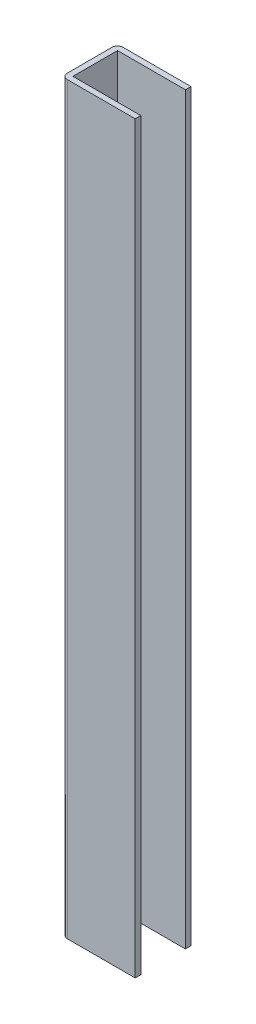
from build123d import *

# Parameters (mm, degrees)
SKETCH_1_W          = 74
SKETCH_1_H          = 24
EXTRUDE_1_DEPTH     = 400
SKETCH_2_W          = 41.646480438
SKETCH_2_H          = 42.526894273
CUT_EXTRUDE_1_DEPTH = 403.27478171


with BuildPart() as part:
    # Эскиз1 → Вытянуть-Тонкостенный1 (new body)
    with BuildSketch(Plane(origin=(0, 0, 0), x_dir=(1, 0, 0), z_dir=(0, 1, 0))):
        with BuildLine():
            Line((40, 12), (40, -12))
            ThreePointArc((40, -12), (39.121320344, -14.121320344), (37, -15))
            Line((37, -15), (-37, -15))
            ThreePointArc((-37, -15), (-39.121320344, -14.121320344), (-40, -12))
            Line((-40, -12), (-40, 12))
            ThreePointArc((-40, 12), (-39.121320344, 14.121320344), (-37, 15))
            Line((-37, 15), (37, 15))
            ThreePointArc((37, 15), (39.121320344, 14.121320344), (40, 12))
        make_face()
        Rectangle(SKETCH_1_W, SKETCH_1_H, mode=Mode.SUBTRACT)
    extrude(amount=EXTRUDE_1_DEPTH)

    # Эскиз2 → Вырез-Вытянуть1 (cut, through all)
    with BuildSketch(Plane(origin=(0, 400, 0), x_dir=(1, 0, 0), z_dir=(0, 1, 0))):
        with Locations((20.323240219, -0.290673418)):
            Rectangle(SKETCH_2_W, SKETCH_2_H)
    extrude(amount=-CUT_EXTRUDE_1_DEPTH, mode=Mode.SUBTRACT)


solid = part.part
